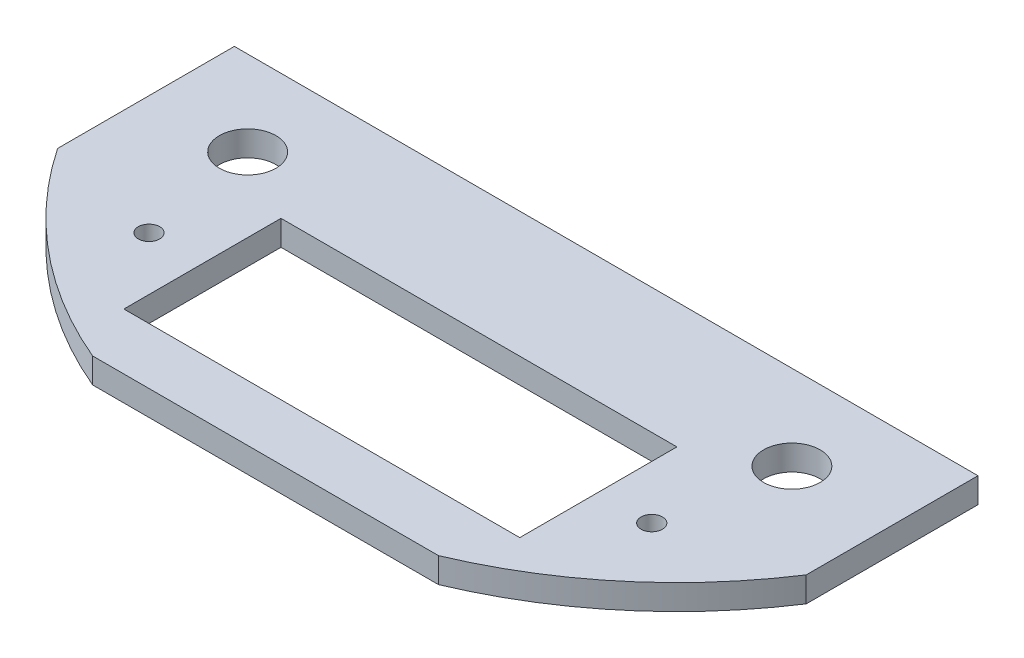
from build123d import *

# Parameters (mm, degrees)
ESQUISSE1_W             = 63
ESQUISSE1_H             = 25
BOSS_EXTRU_1_DEPTH      = 4
D_GAGEMENT_M81_D        = 9
ESQUISSE5_R             = 96
ESQUISSE5_R_2           = 71
ENL_V_MAT_EXTRU_1_DEPTH = 68.845644546
D_GAGEMENT_M31_D        = 3.4


with BuildPart() as part:
    # Esquisse1 → Boss.-Extru.1 (new body)
    with BuildSketch(Plane(origin=(0, 0, 0), x_dir=(1, 0, 0), z_dir=(0, 1, 0))):
        Polygon((-58.901607841, 6.711500167), (-58.901607841, 32.486170288), (59.427941441, 32.486170288), (59.427941441, 7.487213227), (59.427941441, -21.450828615), (-58.901607841, -21.450828615), align=None)
        Rectangle(ESQUISSE1_W, ESQUISSE1_H, mode=Mode.SUBTRACT)
    extrude(amount=BOSS_EXTRU_1_DEPTH)

    # Dégagement M81 (through all)
    with Locations(Plane(origin=(0, 4, 0), x_dir=(1, 0, 0), z_dir=(0, 1, 0))):
        with Locations((-43.3, 19), (43.3, 19)):
            Hole(D_GAGEMENT_M81_D / 2)

    # Esquisse5 → Enlèv. mat.-Extru.1 (cut, through all)
    with BuildSketch(Plane(origin=(0, 4, 0), x_dir=(1, 0, 0), z_dir=(0, 1, 0))):
        with Locations((0, 44.002199903)):
            Circle(ESQUISSE5_R)
        with Locations((0, 44.002199903)):
            Circle(ESQUISSE5_R_2, mode=Mode.SUBTRACT)
    extrude(amount=-ENL_V_MAT_EXTRU_1_DEPTH, mode=Mode.SUBTRACT)

    # Dégagement M31 (through all)
    with Locations(Plane(origin=(0, 0, 0), x_dir=(-1, 0, 0), z_dir=(0, -1, 0))):
        with Locations((-40, 0), (40, 0)):
            Hole(D_GAGEMENT_M31_D / 2)


solid = part.part
